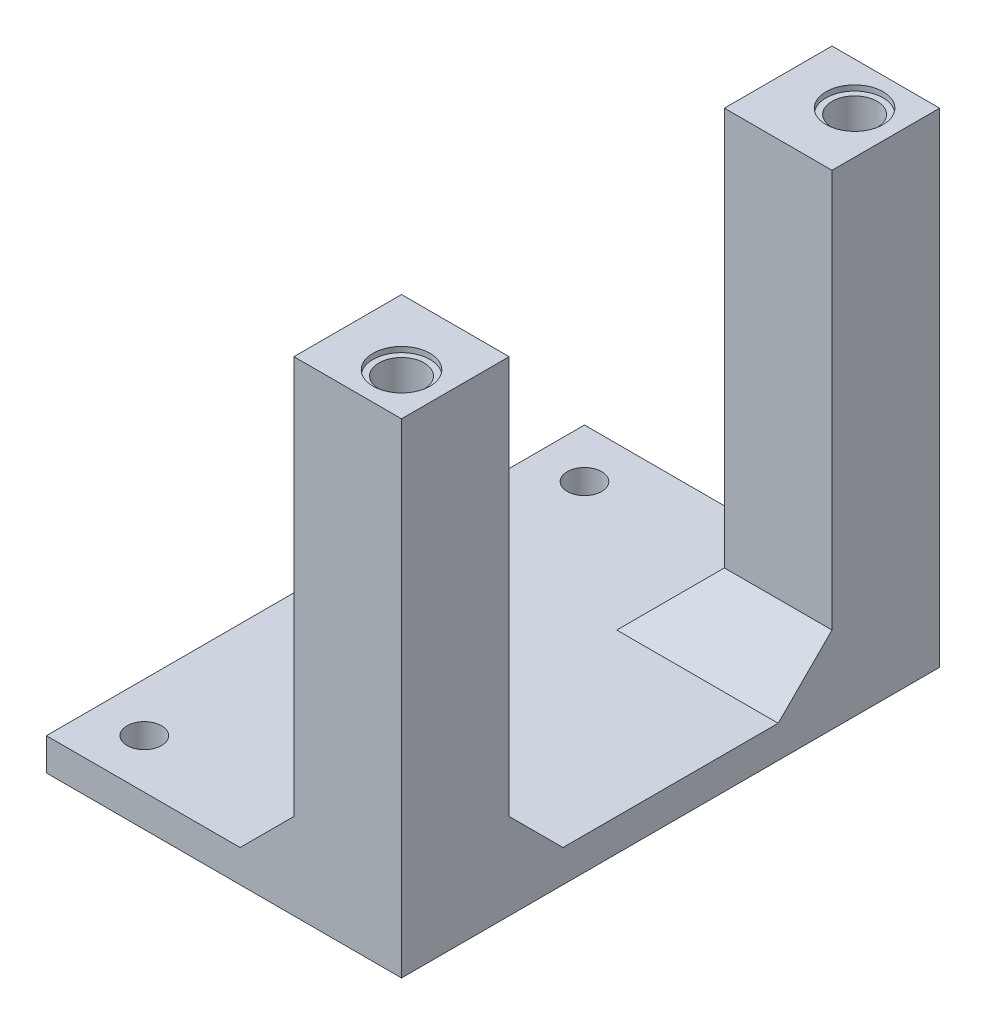
from build123d import *

# Parameters (mm, degrees)
SKETCH1_R           = 1.6
BOSS_EXTRUDE1_DEPTH = 3
SKETCH2_W           = 10
SKETCH2_H           = 10
BOSS_EXTRUDE2_DEPTH = 42
CHAMFER1_SIZE       = 5
SKETCH3_R           = 2.1
CUT_EXTRUDE1_DEPTH  = 52
SKETCH4_R           = 2.65
CUT_EXTRUDE2_DEPTH  = 0.5


with BuildPart() as part:
    # Sketch1 → Boss-Extrude1 (new body)
    with BuildSketch(Plane(origin=(0, 0, 0), x_dir=(1, 0, 0), z_dir=(0, 1, 0))):
        Polygon((-6.512396694, 9.685950413), (1.487603306, 9.685950413), (26.487603306, 9.685950413), (26.487603306, -40.314049587), (1.487603306, -40.314049587), (-6.512396694, -40.314049587), align=None)
        with Locations((-1.962396694, -35.764049587)):
            Circle(SKETCH1_R, mode=Mode.SUBTRACT)
        with Locations((-1.962396694, 5.135950413)):
            Circle(SKETCH1_R, mode=Mode.SUBTRACT)
    extrude(amount=BOSS_EXTRUDE1_DEPTH)

    # Sketch2 → Boss-Extrude2 (add)
    with BuildSketch(Plane(origin=(0, 3, 0), x_dir=(1, 0, 0), z_dir=(0, 1, 0))):
        with Locations((21.487603306, -35.314049587)):
            Rectangle(SKETCH2_W, SKETCH2_H)
        with Locations((21.487603306, 4.685950413)):
            Rectangle(SKETCH2_W, SKETCH2_H)
    extrude(amount=BOSS_EXTRUDE2_DEPTH)

    # Chamfer1
    chamfer1_edges = [part.edges().sort_by_distance(p)[0] for p in [
        (16.487603306, 3, -4.685950413),
        (21.487603306, 3, 0.314049587),
        (16.487603306, 3, 35.314049587),
        (21.487603306, 3, 30.314049587),
    ]]
    chamfer(chamfer1_edges, length=CHAMFER1_SIZE)

    # Sketch3 → Cut-Extrude1 (cut)
    with BuildSketch(Plane(origin=(0, 45, 0), x_dir=(1, 0, 0), z_dir=(0, 1, 0))):
        with Locations((22.537603306, -36.364049587)):
            Circle(SKETCH3_R)
        with Locations((22.537603306, 5.735950413)):
            Circle(SKETCH3_R)
    extrude(amount=-CUT_EXTRUDE1_DEPTH, mode=Mode.SUBTRACT)

    # Sketch4 → Cut-Extrude2 (cut)
    with BuildSketch(Plane(origin=(0, 45, 0), x_dir=(1, 0, 0), z_dir=(0, 1, 0))):
        with Locations((22.537603306, -36.364049587)):
            Circle(SKETCH4_R)
        with Locations((22.537603306, 5.735950413)):
            Circle(SKETCH4_R)
    cut_extrude2 = extrude(amount=-CUT_EXTRUDE2_DEPTH, mode=Mode.SUBTRACT)

    # Mirror1: Cut-Extrude2 across plane
    add(cut_extrude2.mirror(Plane(origin=(0, 22.5, 0), x_dir=(0, 0, 1), z_dir=(0, -1, 0))), mode=Mode.SUBTRACT)


solid = part.part
